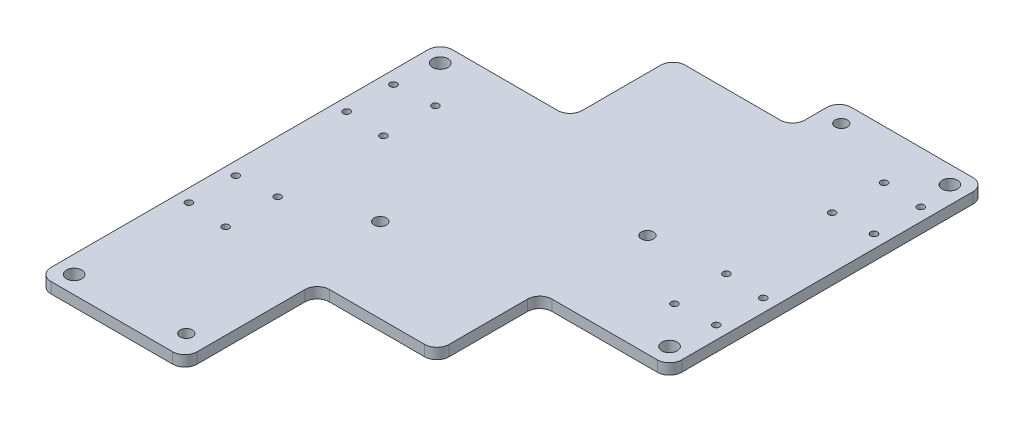
from build123d import *

# Parameters (mm, degrees)
SKETCH1_R          = 3.175
SKETCH1_R_2        = 1.778
BASE_FLANGE1_DEPTH = 5.588
FILLET1_R          = 6.35
CUT_EXTRUDE2_REACH = 196.352
SKETCH3_R          = 3.96875


# Sheet-metal steps are written as plain solids
with BuildPart() as part:
    # Sketch1 → Base-Flange1 (new body)
    with BuildSketch(Plane(origin=(0, 0, 0), x_dir=(1, 0, 0), z_dir=(0, 1, 0))):
        Polygon((-102.488290128, 43.05937504), (-102.488290128, -165.037938429), (-26.750144364, -165.037938429), (-26.750144364, -96.438243977), (35.245709983, -96.438243977), (35.245709983, -43.059375352), (102.488290128, -43.059375352), (102.488290128, 120.582488744), (26.754290128, 120.582488744), (26.754290128, 96.438243353), (-35.245709872, 96.438243353), (-35.245709872, 43.05937504), align=None)
        with Locations(Location((-37.754290017, -153.305196741, 0), (0, 0, 270))):
            Circle(SKETCH1_R, mode=Mode.SUBTRACT)
        with Locations(Location((-37.754290017, -52.76904616, 0), (0, 0, 270))):
            Circle(SKETCH1_R, mode=Mode.SUBTRACT)
        with Locations(Location((37.754290128, 10.201797316, 0), (0, 0, 270))):
            Circle(SKETCH1_R, mode=Mode.SUBTRACT)
        with Locations(Location((37.754290128, 110.737947896, 0), (0, 0, 270))):
            Circle(SKETCH1_R, mode=Mode.SUBTRACT)
        with Locations(Location((95.814087341, 93.888699503, 0), (0, 0, 270))):
            Circle(SKETCH1_R_2, mode=Mode.SUBTRACT)
        with Locations(Location((75.428905946, 95.223880898, 0), (0, 0, 270))):
            Circle(SKETCH1_R_2, mode=Mode.SUBTRACT)
        with Locations(Location((75.428905946, 68.283112535, 0), (0, 0, 270))):
            Circle(SKETCH1_R_2, mode=Mode.SUBTRACT)
        with Locations(Location((95.814087341, 69.61829393, 0), (0, 0, 270))):
            Circle(SKETCH1_R_2, mode=Mode.SUBTRACT)
        with Locations(Location((95.814087341, 12.135202787, 0), (0, 0, 270))):
            Circle(SKETCH1_R_2, mode=Mode.SUBTRACT)
        with Locations(Location((95.814087341, -12.135202787, 0), (0, 0, 270))):
            Circle(SKETCH1_R_2, mode=Mode.SUBTRACT)
        with Locations(Location((75.428905946, 13.470384182, 0), (0, 0, 270))):
            Circle(SKETCH1_R_2, mode=Mode.SUBTRACT)
        with Locations(Location((75.428905946, -13.470384182, 0), (0, 0, 270))):
            Circle(SKETCH1_R_2, mode=Mode.SUBTRACT)
        with Locations(Location((-95.814087341, 12.135202787, 0), (0, 0, 270))):
            Circle(SKETCH1_R_2, mode=Mode.SUBTRACT)
        with Locations(Location((-75.428905946, 13.470384182, 0), (0, 0, 270))):
            Circle(SKETCH1_R_2, mode=Mode.SUBTRACT)
        with Locations(Location((-75.428905946, -13.470384182, 0), (0, 0, 270))):
            Circle(SKETCH1_R_2, mode=Mode.SUBTRACT)
        with Locations(Location((-95.814087341, -12.135202787, 0), (0, 0, 270))):
            Circle(SKETCH1_R_2, mode=Mode.SUBTRACT)
        with Locations(Location((-95.814087341, -69.61829393, 0), (0, 0, 270))):
            Circle(SKETCH1_R_2, mode=Mode.SUBTRACT)
        with Locations(Location((-75.428905946, -68.283112535, 0), (0, 0, 270))):
            Circle(SKETCH1_R_2, mode=Mode.SUBTRACT)
        with Locations(Location((-75.428905946, -95.223880898, 0), (0, 0, 270))):
            Circle(SKETCH1_R_2, mode=Mode.SUBTRACT)
        with Locations(Location((-95.814087341, -93.888699503, 0), (0, 0, 270))):
            Circle(SKETCH1_R_2, mode=Mode.SUBTRACT)
    extrude(amount=-BASE_FLANGE1_DEPTH)

    # Fillet1
    fillet1_edges = [part.edges().sort_by_distance(p)[0] for p in [
        (-35.245709872, -2.794, -43.05937504),
        (-35.245709872, -2.794, -96.438243353),
        (26.754290128, -2.794, -96.438243353),
        (26.754290128, -2.794, -120.582488744),
        (102.488290128, -2.794, -120.582488744),
        (102.488290128, -2.794, 43.059375352),
        (35.245709983, -2.794, 43.059375352),
        (35.245709983, -2.794, 96.438243977),
        (-26.750144364, -2.794, 96.438243977),
        (-26.750144364, -2.794, 165.037938429),
        (-102.488290128, -2.794, 165.037938429),
        (-102.488290128, -2.794, -43.05937504),
    ]]
    fillet(fillet1_edges, radius=FILLET1_R)

    # Sketch3 → Cut-Extrude2 (cut, up to next)
    with BuildSketch(Plane(origin=(0, 0, 0), x_dir=(1, 0, 0), z_dir=(0, 1, 0)), mode=Mode.PRIVATE) as cut_extrude2_sk1:
        with Locations(Location((-93.33196009, 33.903045002, 0), (0, 0, 270))):
            Circle(SKETCH3_R)
    cut_extrude2_tool1 = extrude(cut_extrude2_sk1.sketch, amount=-CUT_EXTRUDE2_REACH, mode=Mode.PRIVATE) & part.part
    # Sketch3 → Cut-Extrude2 (cut, up to next)
    with BuildSketch(Plane(origin=(0, 0, 0), x_dir=(1, 0, 0), z_dir=(0, 1, 0)), mode=Mode.PRIVATE) as cut_extrude2_sk2:
        with Locations(Location((-93.33196009, -155.881608392, 0), (0, 0, 270))):
            Circle(SKETCH3_R)
    cut_extrude2_tool2 = extrude(cut_extrude2_sk2.sketch, amount=-CUT_EXTRUDE2_REACH, mode=Mode.PRIVATE) & part.part
    # Sketch3 → Cut-Extrude2 (cut, up to next)
    with BuildSketch(Plane(origin=(0, 0, 0), x_dir=(1, 0, 0), z_dir=(0, 1, 0)), mode=Mode.PRIVATE) as cut_extrude2_sk3:
        with Locations(Location((93.33196009, 111.426158707, 0), (0, 0, 270))):
            Circle(SKETCH3_R)
    cut_extrude2_tool3 = extrude(cut_extrude2_sk3.sketch, amount=-CUT_EXTRUDE2_REACH, mode=Mode.PRIVATE) & part.part
    # Sketch3 → Cut-Extrude2 (cut, up to next)
    with BuildSketch(Plane(origin=(0, 0, 0), x_dir=(1, 0, 0), z_dir=(0, 1, 0)), mode=Mode.PRIVATE) as cut_extrude2_sk4:
        with Locations(Location((93.33196009, -33.903045314, 0), (0, 0, 270))):
            Circle(SKETCH3_R)
    cut_extrude2_tool4 = extrude(cut_extrude2_sk4.sketch, amount=-CUT_EXTRUDE2_REACH, mode=Mode.PRIVATE) & part.part
    add(cut_extrude2_tool1.solids().sort_by_distance((-93.33196, 0, -33.903045))[0], mode=Mode.SUBTRACT)
    add(cut_extrude2_tool2.solids().sort_by_distance((-93.33196, 0, 155.881608))[0], mode=Mode.SUBTRACT)
    add(cut_extrude2_tool3.solids().sort_by_distance((93.33196, 0, -111.426159))[0], mode=Mode.SUBTRACT)
    add(cut_extrude2_tool4.solids().sort_by_distance((93.33196, 0, 33.903045))[0], mode=Mode.SUBTRACT)


solid = part.part
